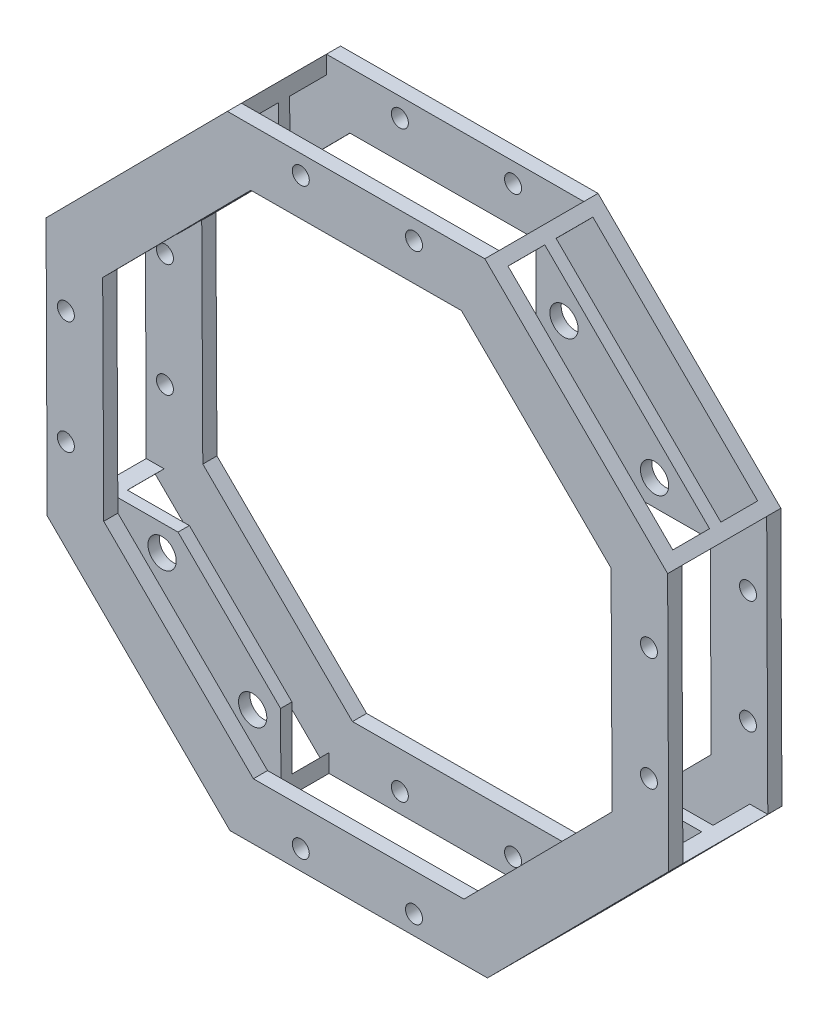
from build123d import *

# Parameters (mm, degrees)
RESSALTO_EXTRUS_O1_DEPTH   = 40
CORTE_EXTRUS_O1_DEPTH      = 250.234507985
CORTE_EXTRUS_O1_DEPTH_BACK = 250.234507985
ESBO_O2_W                  = 30
ESBO_O2_H                  = 90.967932762
CORTE_EXTRUS_O2_DEPTH      = 250.234507985
CORTE_EXTRUS_O2_DEPTH_BACK = 250.234507985
ESBO_O3_W                  = 90.967932762
ESBO_O3_H                  = 30
CORTE_EXTRUS_O3_DEPTH      = 269.368637705
CORTE_EXTRUS_O3_DEPTH_BACK = 269.368637705
ESBO_O4_W                  = 13
ESBO_O4_H                  = 82
CORTE_EXTRUS_O4_DEPTH      = 269.368637705
CORTE_EXTRUS_O4_DEPTH_BACK = 269.368637705
ESBO_O5_W                  = 13
ESBO_O5_H                  = 82
CORTE_EXTRUS_O6_DEPTH      = 160.452187191
CORTE_EXTRUS_O6_DEPTH_BACK = 160.452187191
ESBO_O7_R                  = 3
ESBO_O6_R                  = 5
CORTE_EXTRUS_O5_DEPTH      = 10


with BuildPart() as part:
    # Esboço1 → Ressalto-extrusão1 (new body)
    with BuildSketch(Plane.XY):
        Polygon((109.614040303, 45.949451558), (45.017662423, 110), (-45.949451558, 109.614040303), (-110, 45.017662423), (-109.614040303, -45.949451558), (-45.017662423, -110), (45.949451558, -109.614040303), (110, -45.017662423), align=None)
        Polygon((89.622191138, 37.657029476), (36.744918196, 90), (-37.657029476, 89.622191138), (-90, 36.744918196), (-89.622191138, -37.657029476), (-36.744918196, -90), (37.657029476, -89.622191138), (90, -36.744918196), align=None, mode=Mode.SUBTRACT)
    extrude(amount=RESSALTO_EXTRUS_O1_DEPTH)

    # Esboço2 → Corte-extrusão1 (cut, two sides: drawn at the far end of the back side and taken through both)
    with BuildSketch(Plane(origin=(109.807020152, 0.465894567, 0), x_dir=(0, 0, -1), z_dir=(0.9999909992391912, 0.004242810460553787, 0)).offset(-CORTE_EXTRUS_O1_DEPTH_BACK)):
        with Locations((-20, 0)):
            Rectangle(ESBO_O2_W, ESBO_O2_H)
    extrude(amount=CORTE_EXTRUS_O1_DEPTH + CORTE_EXTRUS_O1_DEPTH_BACK, mode=Mode.SUBTRACT)

    # Esboço3 → Corte-extrusão2 (cut, two sides: drawn at the far end of the back side and taken through both)
    with BuildSketch(Plane(origin=(-0.465894567, 109.807020152, 0), x_dir=(0.9999909992391912, 0.004242810460554241, 0), z_dir=(-0.004242810460554241, 0.9999909992391912, 0)).offset(-CORTE_EXTRUS_O2_DEPTH_BACK)):
        with Locations((0, -20)):
            Rectangle(ESBO_O3_W, ESBO_O3_H)
    extrude(amount=CORTE_EXTRUS_O2_DEPTH + CORTE_EXTRUS_O2_DEPTH_BACK, mode=Mode.SUBTRACT)

    # Esboço4 → Corte-extrusão3 (cut, two sides: drawn at the far end of the back side and taken through both)
    with BuildSketch(Plane(origin=(77.315851363, 77.974725779, 0), x_dir=(0, 0, -1), z_dir=(0.7041002966395966, 0.7101005367354908, 0)).offset(-CORTE_EXTRUS_O3_DEPTH_BACK)):
        with Locations((-28.5, 0)):
            Rectangle(ESBO_O4_W, ESBO_O4_H)
        with Locations((-11.5, 0)):
            Rectangle(ESBO_O4_W, ESBO_O4_H)
    extrude(amount=CORTE_EXTRUS_O3_DEPTH + CORTE_EXTRUS_O3_DEPTH_BACK, mode=Mode.SUBTRACT)

    # Esboço5 → Corte-extrusão4 (cut, two sides: drawn at the far end of the back side and taken through both)
    with BuildSketch(Plane(origin=(-77.974725779, 77.315851363, 0), x_dir=(0, 0, 1), z_dir=(-0.7101005367354906, 0.7041002966395968, 0)).offset(-CORTE_EXTRUS_O4_DEPTH_BACK)):
        with Locations((28.5, 0)):
            Rectangle(ESBO_O5_W, ESBO_O5_H)
        with Locations((11.5, 0)):
            Rectangle(ESBO_O5_W, ESBO_O5_H)
    extrude(amount=CORTE_EXTRUS_O4_DEPTH + CORTE_EXTRUS_O4_DEPTH_BACK, mode=Mode.SUBTRACT)

    # Esboço7 → Corte-extrusão6 (cut, two sides: drawn at the far end of the back side and taken through both)
    with BuildSketch(Plane.XY.offset(5).offset(-CORTE_EXTRUS_O6_DEPTH_BACK)):
        with Locations((-20, 103)):
            Circle(ESBO_O7_R)
        with Locations((20, 103)):
            Circle(ESBO_O7_R)
        with Locations((-20, -103)):
            Circle(ESBO_O7_R)
        with Locations((20, -103)):
            Circle(ESBO_O7_R)
        with Locations((-103, 20)):
            Circle(ESBO_O7_R)
        with Locations((-103, -20)):
            Circle(ESBO_O7_R)
        with Locations((103, 20)):
            Circle(ESBO_O7_R)
        with Locations((103, -20)):
            Circle(ESBO_O7_R)
    extrude(amount=CORTE_EXTRUS_O6_DEPTH + CORTE_EXTRUS_O6_DEPTH_BACK, mode=Mode.SUBTRACT)

    # Esboço6 → Corte-extrusão5 (cut)
    with BuildSketch(Plane(origin=(0, 0, 18), x_dir=(-1, 0, 0), z_dir=(0, 0, -1))):
        with Locations((-87, -55)):
            Circle(ESBO_O6_R)
        with Locations((-55, -87)):
            Circle(ESBO_O6_R)
        with Locations((55, 87)):
            Circle(ESBO_O6_R)
        with Locations((87, 55)):
            Circle(ESBO_O6_R)
        with Locations((-55, 87)):
            Circle(ESBO_O6_R)
        with Locations((-87, 55)):
            Circle(ESBO_O6_R)
        with Locations((87, -55)):
            Circle(ESBO_O6_R)
        with Locations((55, -87)):
            Circle(ESBO_O6_R)
    extrude(amount=-CORTE_EXTRUS_O5_DEPTH, mode=Mode.SUBTRACT)


solid = part.part
